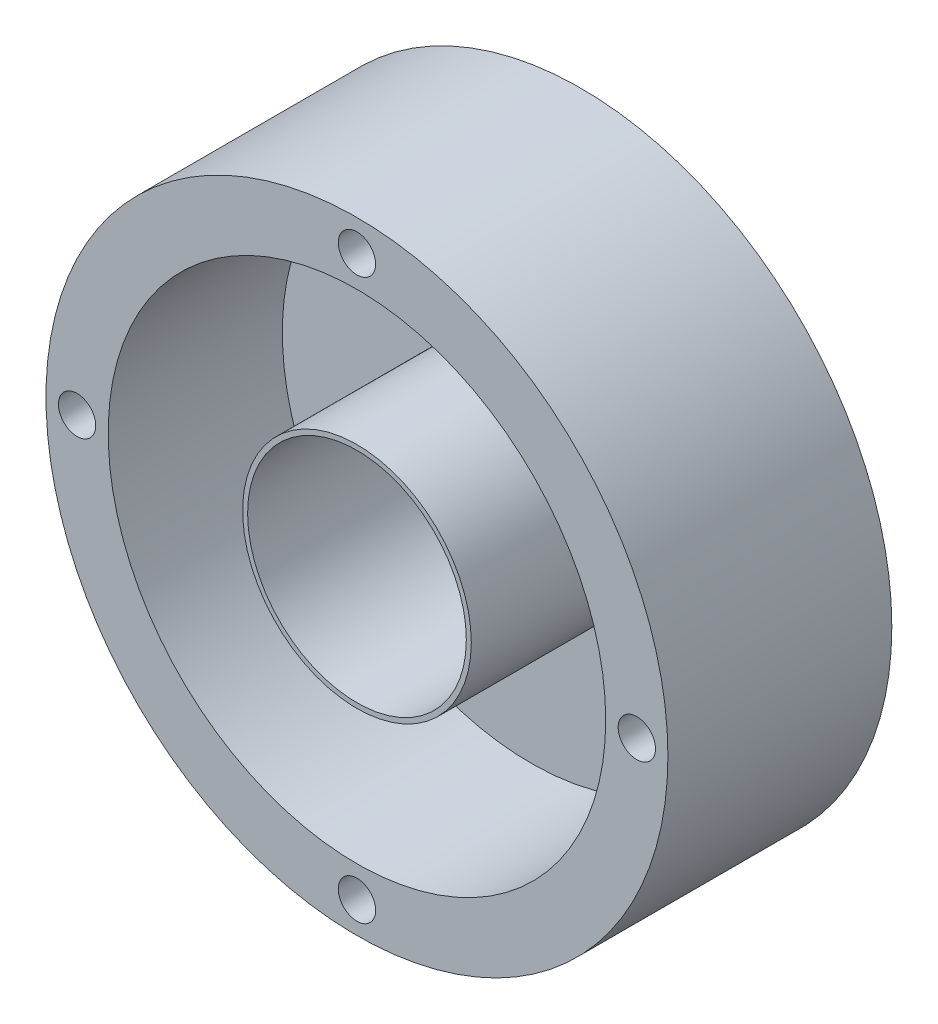
from build123d import *

# Parameters (mm, degrees)
SKETCH1_R               = 25
BOSS_EXTRUDE1_DEPTH     = 18
SKETCH2_R               = 20
CUT_EXTRUDE1_DEPTH      = 14
SKETCH3_W               = 20
SKETCH3_H               = 10
BOSS_EXTRUDE2_DEPTH     = 8
FILLET2_R               = 10
FILLET3_R               = 10
FILLET4_R               = 2
CUT_EXTRUDE2_DEPTH      = 44
CUT_EXTRUDE2_DEPTH_BACK = 44
SKETCH4_W               = 10
SKETCH4_H               = 3.25
CUT_EXTRUDE3_DEPTH      = 44.886216515
CUT_EXTRUDE3_DEPTH_BACK = 44.886216515
SKETCH5_R               = 1.5
SKETCH6_R               = 9.191539394
SKETCH6_R_2             = 8.791539394
BOSS_EXTRUDE3_DEPTH     = 13.4


with BuildPart() as part:
    # Sketch1 → Boss-Extrude1 (new body)
    with BuildSketch(Plane.XY):
        Circle(SKETCH1_R)
    extrude(amount=BOSS_EXTRUDE1_DEPTH)

    # Sketch2 → Cut-Extrude1 (cut)
    with BuildSketch(Plane.XY.offset(18)):
        Circle(SKETCH2_R)
    extrude(amount=-CUT_EXTRUDE1_DEPTH, mode=Mode.SUBTRACT)

    # Sketch3 → Boss-Extrude2 (add)
    with BuildSketch(Plane(origin=(0, 0, 0), x_dir=(-1, 0, 0), z_dir=(0, 0, -1))):
        Rectangle(SKETCH3_W, SKETCH3_H)
    extrude(amount=BOSS_EXTRUDE2_DEPTH)

    # Fillet2
    # the kernel refuses this fillet: 10 mm, written as the material it adds along each edge
    with BuildSketch(Plane(origin=(-10, -5, 0), x_dir=(-1, 0, 0), z_dir=(0, 1, 0)), Plane(origin=(10, 5, 0), x_dir=(1, 0, 0), z_dir=(0, -1, 0))) as fillet2_piece_1:
        with BuildLine():
            CenterArc((9.797958971, -10), FILLET2_R, 90, 78.463040967)
            Line((0, -8), (-0.195959179, -7.96))
            ThreePointArc((-0.195959179, -7.96), (-0.2, -4), (-0.2, 0))
            Line((-0.2, 0), (0, 0.2))
            Line((0, 0.2), (9.797958971, 0.2))
            Line((9.797958971, 0.2), (9.797958971, 0))
        make_face()
    extrude(amount=10)

    # Fillet3
    fillet3_edges = [part.edges().sort_by_distance(p)[0] for p in [
        (-10, 0, -8),
        (10, 0, -8),
    ]]
    fillet(fillet3_edges, radius=FILLET3_R)

    # Fillet4
    fillet4_edges = [part.edges().sort_by_distance(p)[0] for p in [
        (0, 5, 0),
        (0, -5, 0),
    ]]
    fillet(fillet4_edges, radius=FILLET4_R)

    # Sketch4 → Cut-Extrude2 (cut, two sides: drawn at the far end of the back side and taken through both)
    with BuildSketch(Plane.XZ.offset(5).offset(-CUT_EXTRUDE2_DEPTH_BACK)):
        with Locations((0, -1.625)):
            Rectangle(SKETCH4_W, SKETCH4_H)
    extrude(amount=CUT_EXTRUDE2_DEPTH + CUT_EXTRUDE2_DEPTH_BACK, mode=Mode.SUBTRACT)

    # Sketch5 → Cut-Extrude3 (cut, two sides: drawn at the far end of the back side and taken through both)
    with BuildSketch(Plane.XY.offset(18).offset(-CUT_EXTRUDE3_DEPTH_BACK)):
        with Locations((0, 22.5)):
            Circle(SKETCH5_R)
        with Locations((22.5, 0)):
            Circle(SKETCH5_R)
        with Locations((0, -22.5)):
            Circle(SKETCH5_R)
        with Locations((-22.5, 0)):
            Circle(SKETCH5_R)
    extrude(amount=CUT_EXTRUDE3_DEPTH + CUT_EXTRUDE3_DEPTH_BACK, mode=Mode.SUBTRACT)


with BuildPart() as body_2:
    # Sketch6 → Boss-Extrude3 (new body)
    with BuildSketch(Plane.XY.offset(18)):
        Circle(SKETCH6_R)
        Circle(SKETCH6_R_2, mode=Mode.SUBTRACT)
    extrude(amount=-BOSS_EXTRUDE3_DEPTH)


solid = Compound([part.part, body_2.part])
